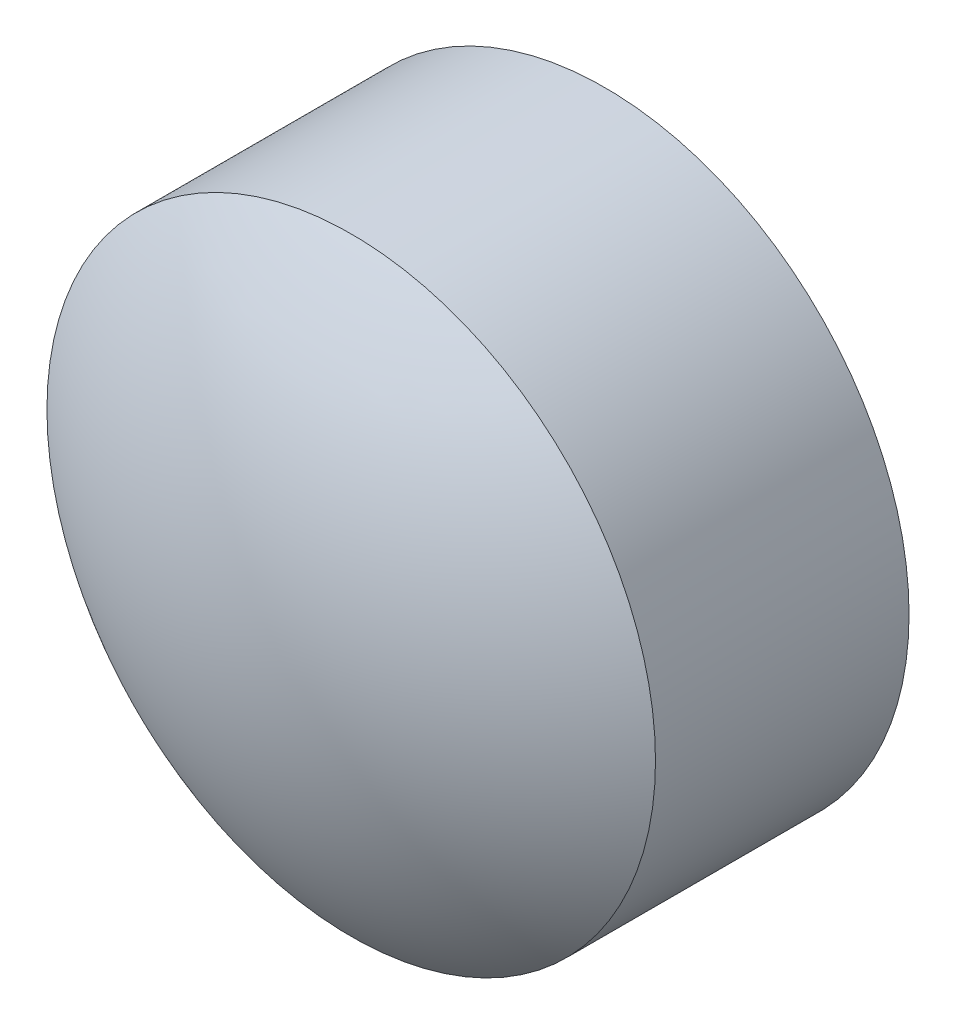
from build123d import *

# Parameters (mm, degrees)
ESQUISSE1_R        = 6
BOSS_EXTRU_1_DEPTH = 5


# Read off the part's stored shape, not the designer's step: Dôme1
with BuildPart() as part:
    # Esquisse1 → Boss.-Extru.1 (new body)
    with BuildSketch(Plane.XY):
        Circle(ESQUISSE1_R)
    extrude(amount=BOSS_EXTRU_1_DEPTH)

    # Dôme1 outline → Dôme1 (revolve)
    with BuildSketch(Plane.XZ):
        with BuildLine():
            Line((0, 5), (6.000000008, 4.999999994))
            ThreePointArc((6.000000008, 4.999999994), (3.162277665, 6.486832979), (0, 7))
            Line((0, 7), (0, 5))
        make_face()
    revolve(axis=Axis((0, 0, 0), (0, 0, 1)))


solid = part.part
